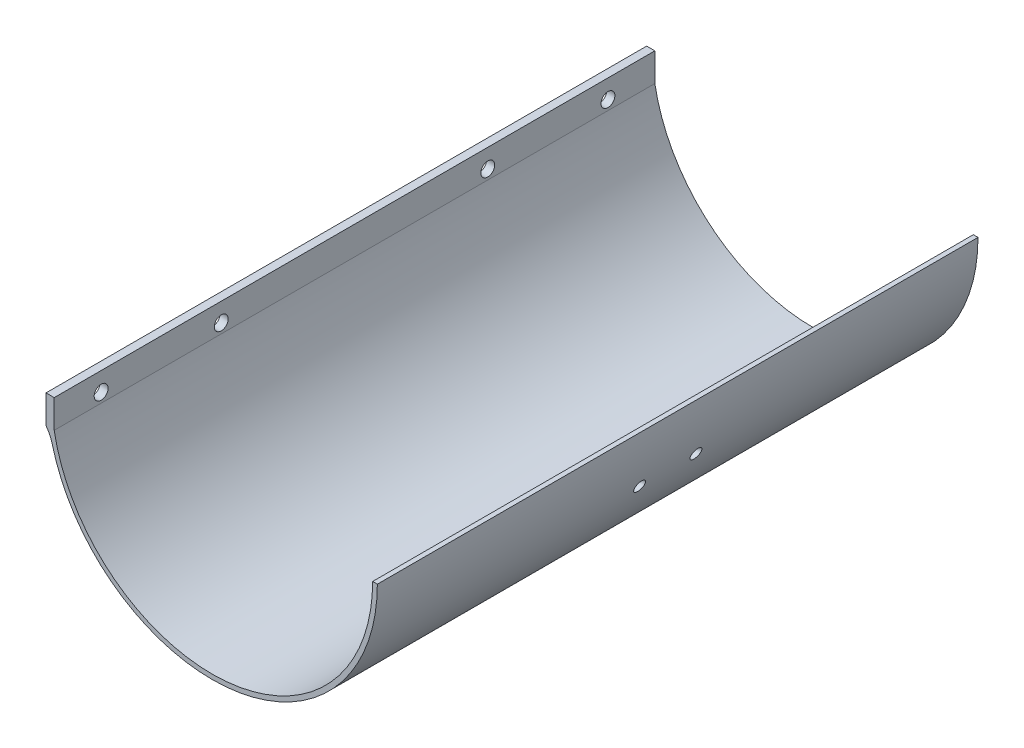
from build123d import *
from build123d.topology import SkipClean

# Parameters (mm, degrees)
BOSS_EXTRUDE1_DEPTH      = 160
CUT_EXTRUDE1_REACH       = 173.674
CUT_EXTRUDE1_END_RADIUS  = 44
SKETCH2_R                = 1.85
BOSS_EXTRUDE2_DEPTH      = 7.5
BOSS_EXTRUDE2_DEPTH_BACK = 7.5
CUT_EXTRUDE2_START       = -160
SKETCH5_W                = 1.237164205
SKETCH5_H                = 7.554303916
CUT_EXTRUDE2_DEPTH       = 160
SKETCH6_W                = 160
SKETCH6_H                = 7.554303916
SKETCH6_R                = 1.85
BOSS_EXTRUDE3_DEPTH      = 0.5
BOSS_EXTRUDE4_DEPTH      = 85
FILLET3_R                = 0.5
CUT_EXTRUDE4_REACH       = 176.326
CUT_EXTRUDE4_END_RADIUS  = 44
SKETCH9_W                = 12
SKETCH9_H                = 6
CUT_EXTRUDE5_DEPTH       = 72
CUT_EXTRUDE6_START       = -160
CUT_EXTRUDE6_DEPTH       = 160
BOSS_EXTRUDE5_DEPTH      = 1
BOSS_EXTRUDE5_DEPTH_BACK = 1.5
SKETCH14_W               = 160
SKETCH14_H               = 7.554303916
SKETCH14_R               = 1.85
SKETCH17_W               = 0.3144145
SKETCH17_H               = 160
CUT_EXTRUDE8_DEPTH       = 7.554303916
FILLET4_R                = 10
SKETCH18_W               = 5.679513367
SKETCH18_H               = 15.054755776
CUT_EXTRUDE9_DEPTH       = 15
CUT_EXTRUDE10_REACH      = 211.375
CUT_EXTRUDE10_END_RADIUS = 44
CUT_EXTRUDE10_START      = 20
SKETCH19_R               = 1.5
BOSS_EXTRUDE6_DEPTH      = 13


with BuildPart() as part:
    # Sketch1 → Boss-Extrude1 (new body)
    with BuildSketch(Plane.XY):
        with BuildLine():
            Line((-44, 0), (-42.75, 0))
            ThreePointArc((-42.75, 0), (0, -42.75), (42.75, 0))
            Line((42.75, 0), (44, 0))
            ThreePointArc((44, 0), (0, -44), (-44, 0))
        make_face()
    extrude(amount=BOSS_EXTRUDE1_DEPTH)

    # Cut-Extrude1: up to this cylinder (the profile starts inside it)
    cut_extrude1_end = Plane(origin=(0, 0, 80), z_dir=(0, 0, -1)) * Cylinder(CUT_EXTRUDE1_END_RADIUS, 571.348, mode=Mode.PRIVATE)
    # Sketch2 → Cut-Extrude1 (cut, up to the surface)
    with BuildSketch(Plane(origin=(0, 0, 0), x_dir=(0, 0, -1), z_dir=(1, 0, 0)), mode=Mode.PRIVATE) as cut_extrude1_sk1:
        with Locations((-147.5, -5)):
            Circle(SKETCH2_R)
    cut_extrude1_tool1 = extrude(cut_extrude1_sk1.sketch, amount=-CUT_EXTRUDE1_REACH, mode=Mode.PRIVATE) & cut_extrude1_end
    add(cut_extrude1_tool1.solids().sort_by_distance((0, -5, 147.5))[0], mode=Mode.SUBTRACT)
    # Sketch2 → Cut-Extrude1 (cut, up to the surface)
    with BuildSketch(Plane(origin=(0, 0, 0), x_dir=(0, 0, -1), z_dir=(1, 0, 0)), mode=Mode.PRIVATE) as cut_extrude1_sk2:
        with Locations((-115.5, -5)):
            Circle(SKETCH2_R)
    cut_extrude1_tool2 = extrude(cut_extrude1_sk2.sketch, amount=-CUT_EXTRUDE1_REACH, mode=Mode.PRIVATE) & cut_extrude1_end
    add(cut_extrude1_tool2.solids().sort_by_distance((0, -5, 115.5))[0], mode=Mode.SUBTRACT)
    # Sketch2 → Cut-Extrude1 (cut, up to the surface)
    with BuildSketch(Plane(origin=(0, 0, 0), x_dir=(0, 0, -1), z_dir=(1, 0, 0)), mode=Mode.PRIVATE) as cut_extrude1_sk3:
        with Locations((-44.5, -5)):
            Circle(SKETCH2_R)
    cut_extrude1_tool3 = extrude(cut_extrude1_sk3.sketch, amount=-CUT_EXTRUDE1_REACH, mode=Mode.PRIVATE) & cut_extrude1_end
    add(cut_extrude1_tool3.solids().sort_by_distance((0, -5, 44.5))[0], mode=Mode.SUBTRACT)
    # Sketch2 → Cut-Extrude1 (cut, up to the surface)
    with BuildSketch(Plane(origin=(0, 0, 0), x_dir=(0, 0, -1), z_dir=(1, 0, 0)), mode=Mode.PRIVATE) as cut_extrude1_sk4:
        with Locations((-12.5, -5)):
            Circle(SKETCH2_R)
    cut_extrude1_tool4 = extrude(cut_extrude1_sk4.sketch, amount=-CUT_EXTRUDE1_REACH, mode=Mode.PRIVATE) & cut_extrude1_end
    add(cut_extrude1_tool4.solids().sort_by_distance((0, -5, 12.5))[0], mode=Mode.SUBTRACT)

    # Sketch4 → Boss-Extrude2 (add, two sides: drawn at the far end of the back side and taken through both)
    with SkipClean():  # the faces are left unmerged after this step: merging them gives an invalid solid
        with BuildSketch(Plane(origin=(0, 0, 72), x_dir=(-1, 0, 0), z_dir=(0, 0, -1)).offset(-BOSS_EXTRUDE2_DEPTH_BACK)):
            with BuildLine():
                Line((-42.188440557, 12.495418496), (-40.883089617, 12.495418496))
                ThreePointArc((-40.883089617, 12.495418496), (-42.280696429, 6.317057024), (-42.75, 0))
                Line((-42.75, 0), (-44, 0))
                ThreePointArc((-44, 0), (-43.544755049, 6.31302683), (-42.188440557, 12.495418496))
            make_face()
        extrude(amount=BOSS_EXTRUDE2_DEPTH + BOSS_EXTRUDE2_DEPTH_BACK)

    # Sketch5 → Cut-Extrude2 (cut)
    with SkipClean():  # the faces are left unmerged after this step: merging them gives an invalid solid
        with BuildSketch(Plane.XY.offset(160).offset(CUT_EXTRUDE2_START)):
            with Locations((-43.381417898, -3.777151958)):
                Rectangle(SKETCH5_W, SKETCH5_H)
        extrude(amount=CUT_EXTRUDE2_DEPTH, mode=Mode.SUBTRACT)

    # Sketch6 → Boss-Extrude3 (add)
    with SkipClean():  # the faces are left unmerged after this step: merging them gives an invalid solid
        with BuildSketch(Plane.ZY.offset(42.762835795)):
            with Locations((80, -3.777151958)):
                Rectangle(SKETCH6_W, SKETCH6_H)
            with Locations((12.5, -5)):
                Circle(SKETCH6_R, mode=Mode.SUBTRACT)
            with Locations((44.5, -5)):
                Circle(SKETCH6_R, mode=Mode.SUBTRACT)
            with Locations((115.5, -5)):
                Circle(SKETCH6_R, mode=Mode.SUBTRACT)
            with Locations((147.5, -5)):
                Circle(SKETCH6_R, mode=Mode.SUBTRACT)
        extrude(amount=BOSS_EXTRUDE3_DEPTH)

    # Sketch7 → Boss-Extrude4 (add)
    with SkipClean():  # the faces are left unmerged after this step: merging them gives an invalid solid
        with BuildSketch(Plane.XY.offset(160)):
            with BuildLine():
                Line((3.193641617, -47.271567965), (4.247348412, -46.182404151))
                ThreePointArc((4.247348412, -46.182404151), (-1.361382554, -53.250007087), (-2.652595344, -44.320189404))
                Line((-2.652595344, -44.320189404), (-7.064595581, -42.922505627))
                ThreePointArc((-7.064595581, -42.922505627), (0, -43.5), (7.064595581, -42.922505627))
                Line((7.064595581, -42.922505627), (2.652595344, -44.320189404))
                Line((2.652595344, -44.320189404), (-0.081202248, -45.006637866))
                ThreePointArc((-0.081202248, -45.006637866), (-2.072088401, -51.385243836), (3.193641617, -47.271567965))
            make_face()
        extrude(amount=-BOSS_EXTRUDE4_DEPTH)

    # Fillet3
    fillet3_edges = [part.edges().sort_by_distance(p)[0] for p in [
        (4.247348412, -46.182404151, 117.5),
    ]]
    fillet(fillet3_edges, radius=FILLET3_R)

    # Cut-Extrude4: up to this cylinder (the profile starts inside it)
    with SkipClean():  # the faces are left unmerged after this step: merging them gives an invalid solid
        cut_extrude4_end = Plane(origin=(0, 0, 72), z_dir=(0, 0, -1)) * Cylinder(CUT_EXTRUDE4_END_RADIUS, 441.652, mode=Mode.PRIVATE)
        # Sketch9 → Cut-Extrude4 (cut, up to the surface)
        with BuildSketch(Plane(origin=(0, 0, 0), x_dir=(0, 0, -1), z_dir=(1, 0, 0)), mode=Mode.PRIVATE) as cut_extrude4_sk1:
            with Locations((-72, 5.495418496)):
                Rectangle(SKETCH9_W, SKETCH9_H)
        cut_extrude4_tool1 = extrude(cut_extrude4_sk1.sketch, amount=CUT_EXTRUDE4_REACH, mode=Mode.PRIVATE) & cut_extrude4_end
        add(cut_extrude4_tool1.solids().sort_by_distance((0, 5.495418, 72))[0], mode=Mode.SUBTRACT)

    # Sketch11 → Cut-Extrude5 (cut)
    with SkipClean():  # the faces are left unmerged after this step: merging them gives an invalid solid
        with BuildSketch(Plane.XY.offset(160)):
            with BuildLine():
                Line((6.038191003, -53.758519386), (4.340910446, -43.785345682))
                ThreePointArc((4.340910446, -43.785345682), (0, -44), (-4.340910446, -43.785345682))
                Line((-4.340910446, -43.785345682), (-6.663752415, -46.7537351))
                ThreePointArc((-6.663752415, -46.7537351), (-2.196447495, -53.671825429), (6.038191003, -53.758519386))
            make_face()
        extrude(amount=-CUT_EXTRUDE5_DEPTH, mode=Mode.SUBTRACT)

    # Sketch12 → Cut-Extrude6 (cut)
    with SkipClean():  # the faces are left unmerged after this step: merging them gives an invalid solid
        with BuildSketch(Plane(origin=(0, 0, 0), x_dir=(-1, 0, 0), z_dir=(0, 0, -1)).offset(CUT_EXTRUDE6_START)):
            Polygon((42.75, 0), (42.75, -7.554303916), (41.523020522, -7.554303916), align=None)
        extrude(amount=CUT_EXTRUDE6_DEPTH, mode=Mode.SUBTRACT)

    # Sketch14 → Boss-Extrude5 (add, two sides: drawn at the far end of the back side and taken through both)
    with SkipClean():  # the faces are left unmerged after this step: merging them gives an invalid solid
        with BuildSketch(Plane.ZY.offset(43.262835795).offset(-BOSS_EXTRUDE5_DEPTH_BACK)):
            with Locations((80, -3.777151958)):
                Rectangle(SKETCH14_W, SKETCH14_H)
            with Locations((12.5, -5)):
                Circle(SKETCH14_R, mode=Mode.SUBTRACT)
            with Locations((44.5, -5)):
                Circle(SKETCH14_R, mode=Mode.SUBTRACT)
            with Locations((115.5, -5)):
                Circle(SKETCH14_R, mode=Mode.SUBTRACT)
            with Locations((147.5, -5)):
                Circle(SKETCH14_R, mode=Mode.SUBTRACT)
        extrude(amount=BOSS_EXTRUDE5_DEPTH + BOSS_EXTRUDE5_DEPTH_BACK)

    # Sketch17 → Cut-Extrude8 (cut)
    with SkipClean():  # the faces are left unmerged after this step: merging them gives an invalid solid
        with BuildSketch(Plane.XZ.offset(7.554303916)):
            with Locations((-41.920043045, 80)):
                Rectangle(SKETCH17_W, SKETCH17_H)
        extrude(amount=-CUT_EXTRUDE8_DEPTH, mode=Mode.SUBTRACT)

    # Fillet4
    # the kernel refuses this fillet: 10 mm, written as the material it adds along each edge
    with BuildSketch(Plane(origin=(-43.346654915, -7.554303916, 160), x_dir=(0.21136107775555732, -0.9774080492864836, 0), z_dir=(0, 0, -1))) as fillet4_piece_1:
        with BuildLine():
            CenterArc((3.960443366, 9.991830737), FILLET4_R, 245.454934631, 22.228958211)
            Line((-0.193644978, 0.895482567), (-0.276726745, 0.713555603))
            ThreePointArc((-0.276726745, 0.713555603), (-0.292304099, 0.405469068), (-0.19548161, -0.042272216))
            Line((-0.19548161, -0.042272216), (0.008082537, -0.199836615))
            ThreePointArc((0.008082537, -0.199836615), (1.778158246, -0.164055241), (3.548233954, -0.199836615))
            Line((3.548233954, -0.199836615), (3.556316492, 0))
        make_face()
    extrude(amount=160)

    # Sketch18 → Cut-Extrude9 (cut)
    with BuildSketch(Plane.XY.offset(79.5)):
        with Locations((42.974138408, 7.527377888)):
            Rectangle(SKETCH18_W, SKETCH18_H)
    extrude(amount=-CUT_EXTRUDE9_DEPTH, mode=Mode.SUBTRACT)

    # Cut-Extrude10: up to this cylinder (the profile starts inside it)
    cut_extrude10_end = Plane(origin=(0, 0, 80), z_dir=(0, 0, -1)) * Cylinder(CUT_EXTRUDE10_END_RADIUS, 526.75, mode=Mode.PRIVATE)
    # Sketch19 → Cut-Extrude10 (cut, up to the surface)
    with BuildSketch(Plane(origin=(-42.077250295, 0, 0), x_dir=(0, 0, -1), z_dir=(1, 0, 0)).offset(CUT_EXTRUDE10_START), mode=Mode.PRIVATE) as cut_extrude10_sk1:
        with Locations(Location((-87.5, -15, 0), (0, 0, 180))):
            Circle(SKETCH19_R)
    cut_extrude10_tool1 = extrude(cut_extrude10_sk1.sketch, amount=CUT_EXTRUDE10_REACH, mode=Mode.PRIVATE) & cut_extrude10_end
    add(cut_extrude10_tool1.solids().sort_by_distance((-22.07725, -15, 87.5))[0], mode=Mode.SUBTRACT)
    # Sketch19 → Cut-Extrude10 (cut, up to the surface)
    with BuildSketch(Plane(origin=(-42.077250295, 0, 0), x_dir=(0, 0, -1), z_dir=(1, 0, 0)).offset(CUT_EXTRUDE10_START), mode=Mode.PRIVATE) as cut_extrude10_sk2:
        with Locations(Location((-72.5, -15, 0), (0, 0, 180))):
            Circle(SKETCH19_R)
    cut_extrude10_tool2 = extrude(cut_extrude10_sk2.sketch, amount=CUT_EXTRUDE10_REACH, mode=Mode.PRIVATE) & cut_extrude10_end
    add(cut_extrude10_tool2.solids().sort_by_distance((-22.07725, -15, 72.5))[0], mode=Mode.SUBTRACT)

    # Sketch20 → Boss-Extrude6 (add)
    with BuildSketch(Plane(origin=(0, 0, 75), x_dir=(-1, 0, 0), z_dir=(0, 0, -1))):
        with BuildLine():
            Line((4.237574899, -51.126366777), (9.364668734, -42.991894347))
            ThreePointArc((9.364668734, -42.991894347), (6.86426372, -43.461268776), (4.340910446, -43.785345682))
            Line((4.340910446, -43.785345682), (2.652595344, -44.320189404))
            ThreePointArc((2.652595344, -44.320189404), (4.866254034, -47.392325259), (4.237574899, -51.126366777))
        make_face()
    extrude(amount=-BOSS_EXTRUDE6_DEPTH)


solid = part.part
